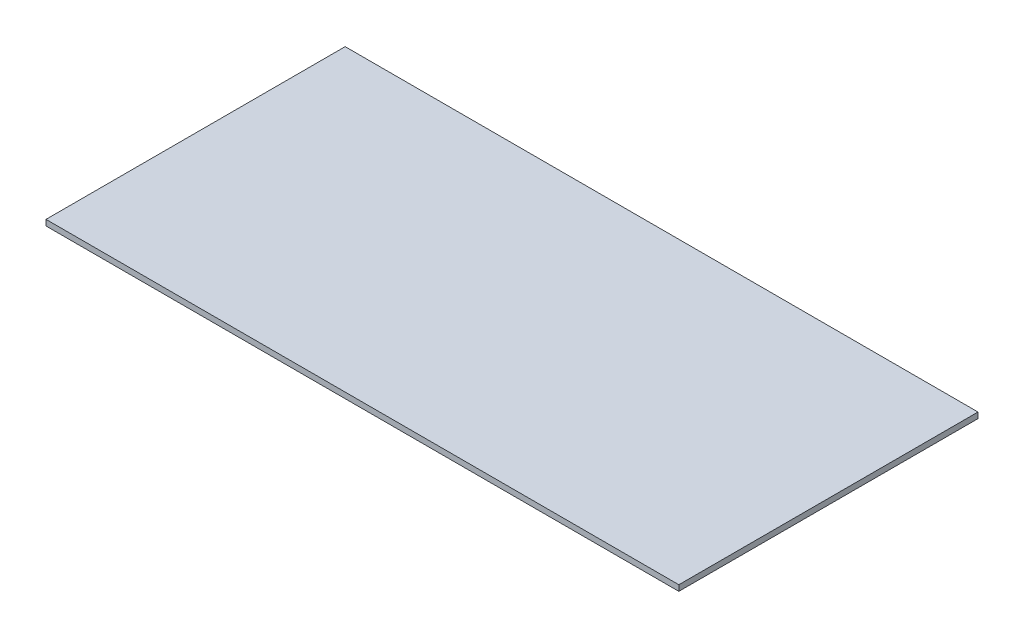
from build123d import *

# Parameters (mm, degrees)
SKETCH_1_W      = 550
SKETCH_1_H      = 260
EXTRUDE_1_DEPTH = 5


with BuildPart() as part:
    # ｽｹｯﾁ1 → ﾎﾞｽ - 押し出し1 (new body)
    with BuildSketch(Plane(origin=(0, 0, 0), x_dir=(1, 0, 0), z_dir=(0, 1, 0))):
        Rectangle(SKETCH_1_W, SKETCH_1_H)
    extrude(amount=EXTRUDE_1_DEPTH)


solid = part.part
